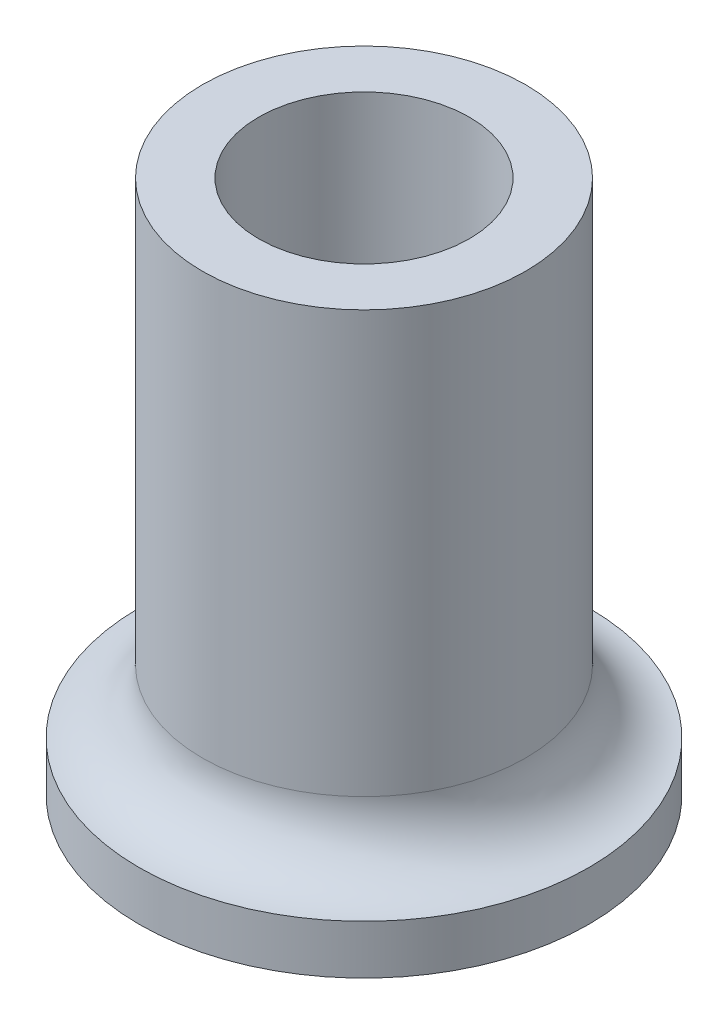
from build123d import *

# Parameters (mm, degrees)
SKETCH_1_R      = 16
SKETCH_1_R_2    = 7.5
EXTRUDE_1_DEPTH = 3.5
SKETCH_2_R      = 11.5
SKETCH_2_R_2    = 7.5
EXTRUDE_2_DEPTH = 34.5
FILLET_3_R      = 4.5


with BuildPart() as part:
    # 草圖1 → 填料-伸長1 (new body)
    with BuildSketch(Plane(origin=(0, 0, 0), x_dir=(1, 0, 0), z_dir=(0, 1, 0))):
        with Locations(Location((0, 0, 0), (0, 0, 270))):
            Circle(SKETCH_1_R)
        with Locations(Location((0, 0, 0), (0, 0, 270))):
            Circle(SKETCH_1_R_2, mode=Mode.SUBTRACT)
    extrude(amount=EXTRUDE_1_DEPTH)

    # 草圖2 → 填料-伸長2 (add)
    with BuildSketch(Plane(origin=(0, 3.5, 0), x_dir=(1, 0, 0), z_dir=(0, 1, 0))):
        with Locations(Location((0, 0, 0), (0, 0, 270))):
            Circle(SKETCH_2_R)
        with Locations(Location((0, 0, 0), (0, 0, 270))):
            Circle(SKETCH_2_R_2, mode=Mode.SUBTRACT)
    extrude(amount=EXTRUDE_2_DEPTH)

    # 圓角3
    fillet_3_edges = [part.edges().sort_by_distance(p)[0] for p in [
        (0, 3.5, -11.5),
    ]]
    fillet(fillet_3_edges, radius=FILLET_3_R - 0.0001)  # a hair under: the kernel refuses the full size


solid = part.part
